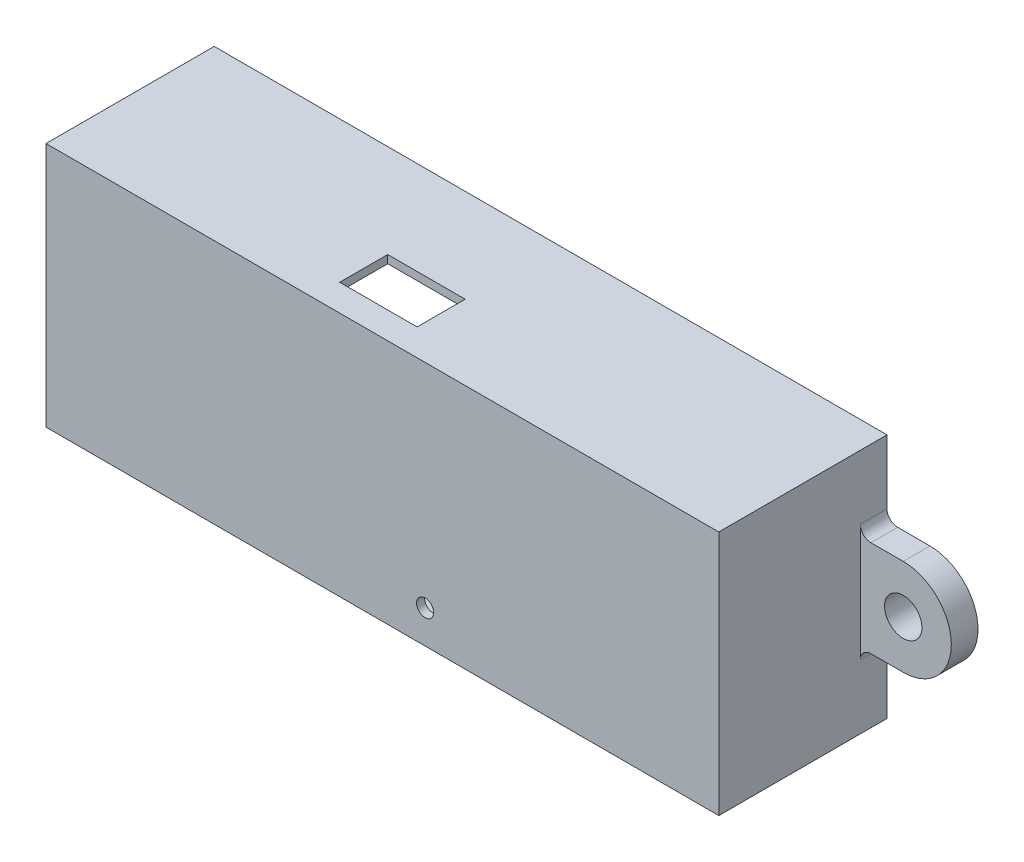
from build123d import *

# Parameters (mm, degrees)
SKETCH_1_W           = 123
SKETCH_1_H           = 43
EXTRUDE_1_DEPTH      = 1.5
EXTRUDE_2_DEPTH      = 30
EXTRUDE_2_DEPTH_BACK = 1.5
SKETCH_2_W           = 126
SKETCH_2_H           = 46
SKETCH_2_W_2         = 123
SKETCH_2_H_2         = 43
SKETCH_3_R           = 3.5
EXTRUDE_3_DEPTH      = 5
SKETCH_5_R           = 1.6
CUT_EXTRUDE_1_DEPTH  = 10
CUT_EXTRUDE_2_DEPTH  = 10
SKETCH_7_W           = 14.5
SKETCH_7_H           = 9
CUT_EXTRUDE_3_DEPTH  = 10
FILLET_1_R           = 2


with BuildPart() as part:
    # Эскиз1 → Бобышка-Вытянуть1 (new body)
    with BuildSketch(Plane.XY):
        with Locations((61.5, 21.5)):
            Rectangle(SKETCH_1_W, SKETCH_1_H)
    extrude(amount=EXTRUDE_1_DEPTH)

    # Эскиз2 → Бобышка-Вытянуть2 (add, two sides: drawn at the far end of the back side and taken through both)
    with BuildSketch(Plane(origin=(0, 0, 0), x_dir=(-1, 0, 0), z_dir=(0, 0, -1)).offset(-EXTRUDE_2_DEPTH_BACK)):
        with Locations((-61.5, 21.5)):
            Rectangle(SKETCH_2_W, SKETCH_2_H)
        with Locations((-61.5, 21.5)):
            Rectangle(SKETCH_2_W_2, SKETCH_2_H_2, mode=Mode.SUBTRACT)
    extrude(amount=EXTRUDE_2_DEPTH + EXTRUDE_2_DEPTH_BACK)

    # Эскиз3 → Бобышка-Вытянуть3 (add)
    with BuildSketch(Plane(origin=(0, 0, -30), x_dir=(-1, 0, 0), z_dir=(0, 0, -1))):
        with BuildLine():
            Line((-124.5, 12.5), (-132.54002612, 12.5))
            ThreePointArc((-132.54002612, 12.5), (-141.54002612, 21.5), (-132.54002612, 30.5))
            Line((-132.54002612, 30.5), (-124.5, 30.5))
            Line((-124.5, 30.5), (-124.5, 12.5))
        make_face()
        with Locations((-132.54002612, 21.5)):
            Circle(SKETCH_3_R, mode=Mode.SUBTRACT)
    extrude_3 = extrude(amount=-EXTRUDE_3_DEPTH)

    # Зеркальное отражение1: Бобышка-Вытянуть3 across plane
    add(extrude_3.mirror(Plane(origin=(61.5, 0, 0), x_dir=(0, 0, 1), z_dir=(1, 0, 0))))

    # Эскиз5 → Вырез-Вытянуть1 (cut)
    with BuildSketch(Plane.XY.offset(1.5)):
        with Locations((69.5, 4.7)):
            Circle(SKETCH_5_R)
    extrude(amount=-CUT_EXTRUDE_1_DEPTH, mode=Mode.SUBTRACT)

    # Эскиз6 → Вырез-Вытянуть2 (cut)
    with BuildSketch(Plane.ZY.offset(1.5)):
        Polygon((-20, 17.3), (-22.5, 17.3), (-25, 17.3), (-25, 16.65), (-25, 9.65), (-25, 8.5), (-22.5, 8.5), (-20, 8.5), align=None)
    extrude(amount=-CUT_EXTRUDE_2_DEPTH, mode=Mode.SUBTRACT)

    # Эскиз7 → Вырез-Вытянуть3 (cut)
    with BuildSketch(Plane(origin=(0, 44.5, 0), x_dir=(1, 0, 0), z_dir=(0, 1, 0))):
        with Locations((55.75, 8)):
            Rectangle(SKETCH_7_W, SKETCH_7_H)
    extrude(amount=-CUT_EXTRUDE_3_DEPTH, mode=Mode.SUBTRACT)

    # Скругление1
    fillet_1_edges = [part.edges().sort_by_distance(p)[0] for p in [
        (124.5, 12.5, -27.5),
        (124.5, 30.5, -27.5),
        (-1.5, 30.5, -27.5),
        (-1.5, 12.5, -27.5),
    ]]
    fillet(fillet_1_edges, radius=FILLET_1_R)


solid = part.part
